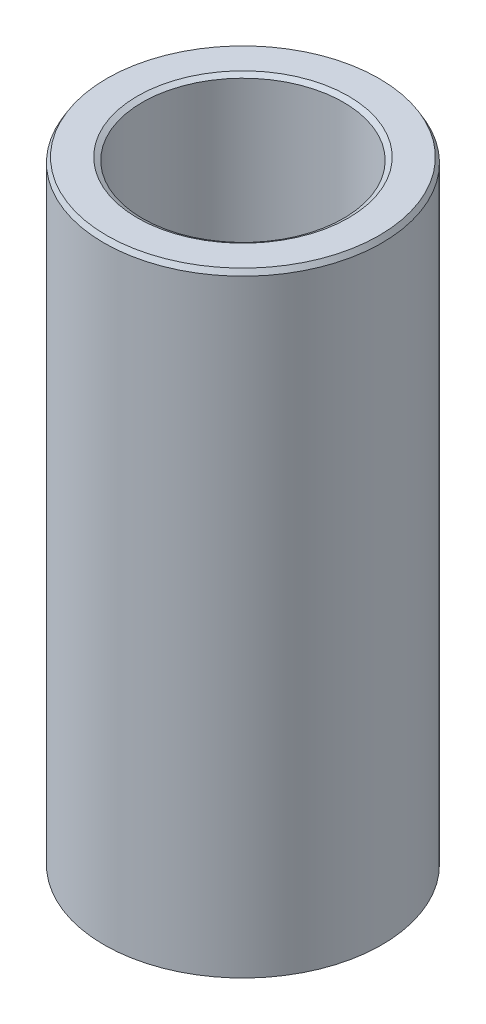
from build123d import *
from OCP.BRepFilletAPI import BRepFilletAPI_MakeChamfer

# Parameters (mm, degrees)
SKETCH1_R           = 27.5
BOSS_EXTRUDE1_DEPTH = 121.830156163
SKETCH2_R           = 19.905989837
CUT_EXTRUDE1_DEPTH  = 128.88700853
CHAMFER1_SIZE       = 0.985257072
CHAMFER1_SIZE2      = 0.568838436


with BuildPart() as part:
    # Sketch1 → Boss-Extrude1 (new body)
    with BuildSketch(Plane(origin=(0, 0, 0), x_dir=(1, 0, 0), z_dir=(0, 1, 0))):
        Circle(SKETCH1_R)
    extrude(amount=BOSS_EXTRUDE1_DEPTH)

    # Sketch2 → Cut-Extrude1 (cut, through all)
    with BuildSketch(Plane(origin=(0, 0, 0), x_dir=(1, 0, 0), z_dir=(0, 1, 0))):
        Circle(SKETCH2_R)
    extrude(amount=CUT_EXTRUDE1_DEPTH, mode=Mode.SUBTRACT)

    # Chamfer1: one chamfer whose edges measure the first distance from different faces: ONE call of the kernel's chamfer builder (chamfer() names one face for all edges)
    chamfer1_edges_1 = [part.edges().sort_by_distance(p)[0] for p in [
        (-19.905989837, 121.830156163, 0),
    ]]
    chamfer1_side_1 = [part.faces().sort_by_distance(p)[0] for p in [
        (-26.722182541, 121.830156163, 0),
    ]]
    chamfer1_edges_2 = [part.edges().sort_by_distance(p)[0] for p in [
        (-19.905989837, 0, 0),
    ]]
    chamfer1_side_2 = [part.faces().sort_by_distance(p)[0] for p in [
        (-19.905989837, 60.915078082, 0),
    ]]
    chamfer1_edges_3 = [part.edges().sort_by_distance(p)[0] for p in [
        (-27.5, 0, 0),
    ]]
    chamfer1_side_3 = [part.faces().sort_by_distance(p)[0] for p in [
        (-26.722182541, 0, 0),
    ]]
    chamfer1_edges_4 = [part.edges().sort_by_distance(p)[0] for p in [
        (-27.5, 121.830156163, 0),
    ]]
    chamfer1_side_4 = [part.faces().sort_by_distance(p)[0] for p in [
        (-27.5, 60.915078082, 0),
    ]]
    chamfer1 = BRepFilletAPI_MakeChamfer(part.part.solid().wrapped)
    for e in chamfer1_edges_1:
        chamfer1.Add(CHAMFER1_SIZE, CHAMFER1_SIZE2, e.wrapped, chamfer1_side_1[0].wrapped)  # the first distance lies on this face
    for e in chamfer1_edges_2:
        chamfer1.Add(CHAMFER1_SIZE, CHAMFER1_SIZE2, e.wrapped, chamfer1_side_2[0].wrapped)  # the first distance lies on this face
    for e in chamfer1_edges_3:
        chamfer1.Add(CHAMFER1_SIZE, CHAMFER1_SIZE2, e.wrapped, chamfer1_side_3[0].wrapped)  # the first distance lies on this face
    for e in chamfer1_edges_4:
        chamfer1.Add(CHAMFER1_SIZE, CHAMFER1_SIZE2, e.wrapped, chamfer1_side_4[0].wrapped)  # the first distance lies on this face
    add(Compound.cast(chamfer1.Shape()), mode=Mode.REPLACE)


solid = part.part
